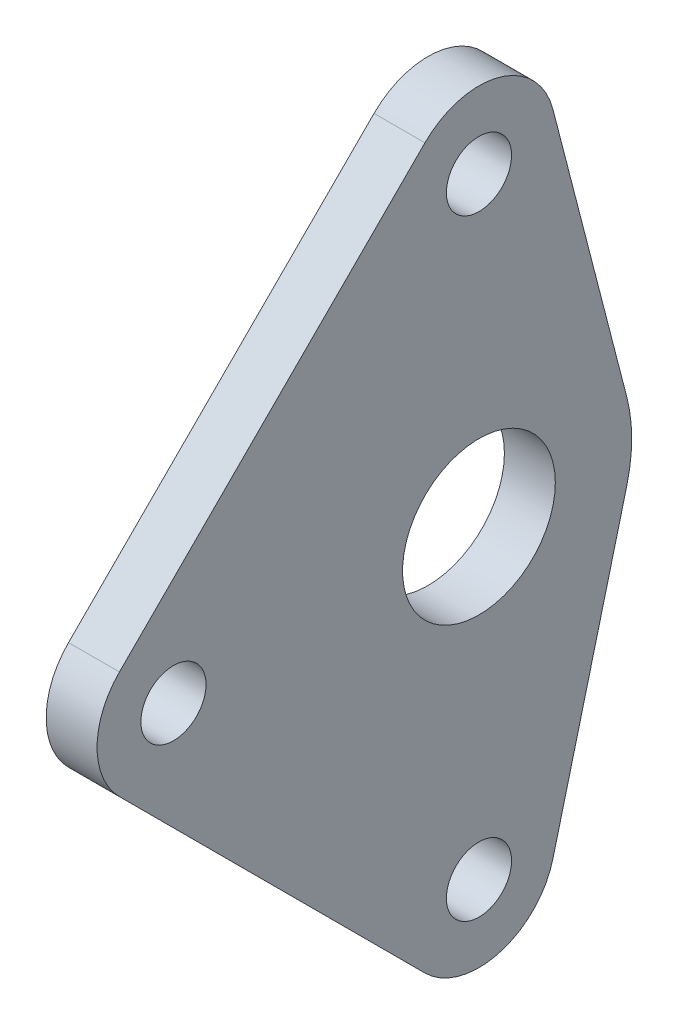
from build123d import *

# Parameters (mm, degrees)
SKETCH1_R           = 4.7625
SKETCH1_R_2         = 2.032
BOSS_EXTRUDE1_DEPTH = 3.175


with BuildPart() as part:
    # Sketch1 → Boss-Extrude1 (new body)
    with BuildSketch(Plane(origin=(0, 0, 0), x_dir=(0, 0, -1), z_dir=(1, 0, 0))):
        with BuildLine():
            Line((-3.367596045, 22.417596045), (-22.417596045, 3.367596045))
            ThreePointArc((-22.417596045, 3.367596045), (-23.8125, 0), (-22.417596045, -3.367596045))
            Line((-22.417596045, -3.367596045), (-3.367596045, -22.417596045))
            ThreePointArc((-3.367596045, -22.417596045), (1.253587833, -23.64455371), (4.611270797, -20.240625))
            Line((4.611270797, -20.240625), (9.222541593, -2.38125))
            ThreePointArc((9.222541593, -2.38125), (9.525, 0), (9.222541593, 2.38125))
            Line((9.222541593, 2.38125), (4.611270797, 20.240625))
            ThreePointArc((4.611270797, 20.240625), (1.253587833, 23.64455371), (-3.367596045, 22.417596045))
        make_face()
        Circle(SKETCH1_R, mode=Mode.SUBTRACT)
        with Locations((0, 19.05)):
            Circle(SKETCH1_R_2, mode=Mode.SUBTRACT)
        with Locations((-19.05, 0)):
            Circle(SKETCH1_R_2, mode=Mode.SUBTRACT)
        with Locations((0, -19.05)):
            Circle(SKETCH1_R_2, mode=Mode.SUBTRACT)
    extrude(amount=BOSS_EXTRUDE1_DEPTH)


solid = part.part
